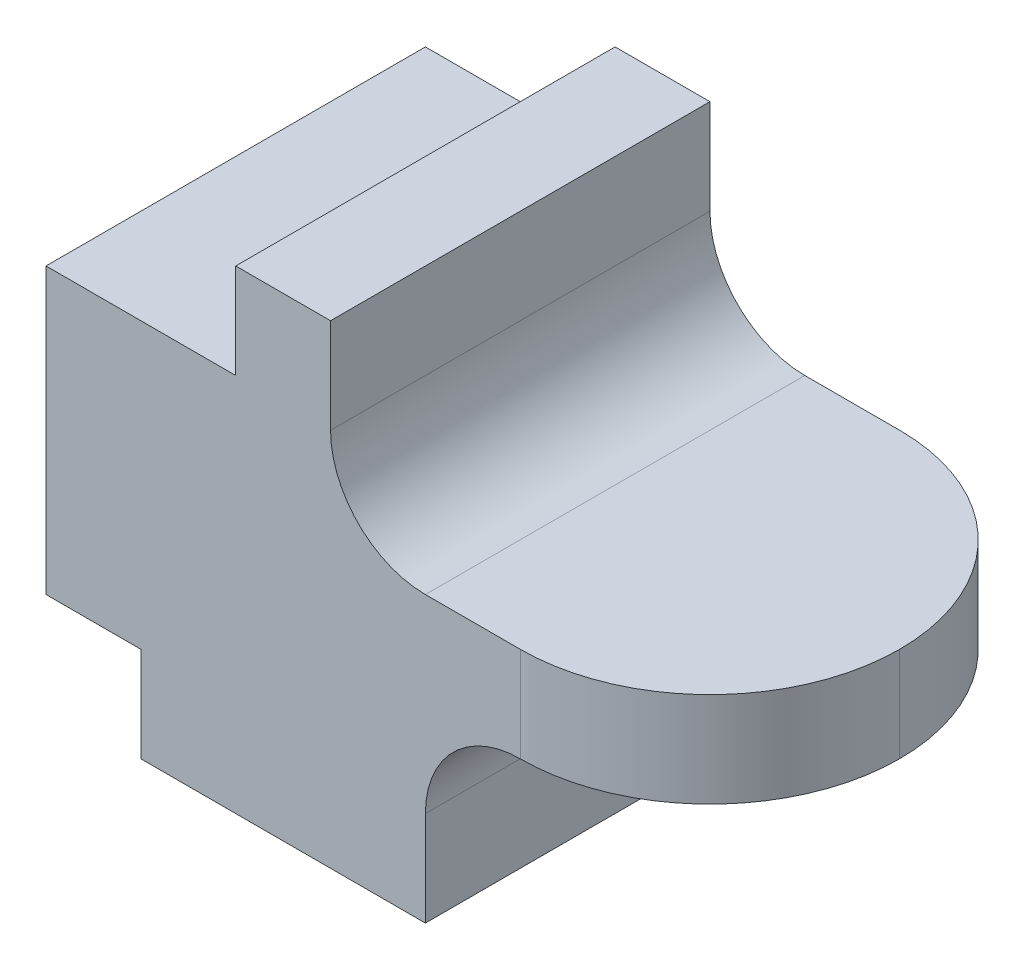
from build123d import *

# Parameters (mm, degrees)
EXTRUDE_1_DEPTH = 20
FILLET_2_R      = 10
FILLET_1_R      = 5


with BuildPart() as part:
    # 草圖1 → 填料-伸長1 (new body)
    with BuildSketch(Plane.XY):
        Polygon((0, 0), (0, 15), (10, 15), (10, 20), (15, 20), (15, 10), (35, 10), (35, 5), (20, 5), (20, -5), (5, -5), (5, 0), align=None)
    extrude(amount=EXTRUDE_1_DEPTH)

    # 圓角2
    fillet_2_edges = [part.edges().sort_by_distance(p)[0] for p in [
        (35, 7.5, 0),
        (35, 7.5, 20),
    ]]
    fillet(fillet_2_edges, radius=FILLET_2_R - 0.0001)  # a hair under: the kernel refuses the full size

    # 圓角1
    fillet_1_edges = [part.edges().sort_by_distance(p)[0] for p in [
        (20, 5, 10),
        (15, 10, 10),
    ]]
    fillet(fillet_1_edges, radius=FILLET_1_R)


solid = part.part
